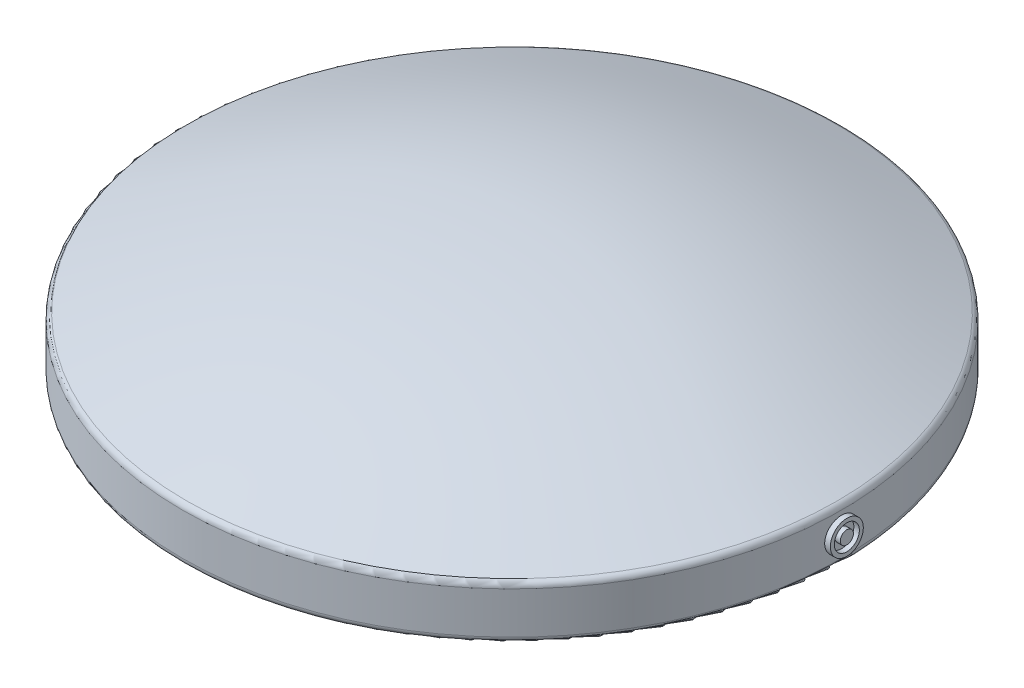
from build123d import *

# Parameters (mm, degrees)
REVOLVE_THIN1_START         = 9.845636472
REVOLVE_THIN1_OUTLINE_R     = 240
REVOLVE_THIN1_DEPTH         = 66.631387698
REVOLVE_THIN1_START_2       = -23.52297593
REVOLVE_THIN1_2_OUTLINE_R   = 250
REVOLVE_THIN1_2_DEPTH       = 10
REVOLVE_THIN1_START_3       = -13.52297593
REVOLVE_THIN1_3_OUTLINE_R   = 250
REVOLVE_THIN1_3_OUTLINE_R_2 = 240
REVOLVE_THIN1_3_DEPTH       = 80.0000001
BOSS_EXTRUDE1_DEPTH         = 254
BOSS_EXTRUDE1_DEPTH_BACK    = 254
SKETCH3_R                   = 12.5
SKETCH3_R_2                 = 9.5
BOSS_EXTRUDE2_DEPTH         = 254
BOSS_EXTRUDE2_DEPTH_BACK    = 254
SKETCH4_R                   = 5


with BuildPart() as part:
    # Revolve-Thin1: read off the stored shape, not the designer's step
    # Revolve-Thin1 outline → Revolve-Thin1 (new body)
    with BuildSketch(Plane(origin=(0, 0, 0), x_dir=(1, 0, 0), z_dir=(0, 1, 0)).offset(REVOLVE_THIN1_START)):
        Circle(REVOLVE_THIN1_OUTLINE_R)
    extrude(amount=REVOLVE_THIN1_DEPTH)



with BuildPart() as body_2:
    # Revolve-Thin1 2 outline → Revolve-Thin1 2 (new body)
    with BuildSketch(Plane(origin=(0, 0, 0), x_dir=(1, 0, 0), z_dir=(0, 1, 0)).offset(REVOLVE_THIN1_START_2)):
        Circle(REVOLVE_THIN1_2_OUTLINE_R)
    extrude(amount=REVOLVE_THIN1_2_DEPTH)


with BuildPart() as part_1:
    add(part.part)

    add(body_2.part)  # Revolve-Thin1 3 merges body 2
    # Revolve-Thin1 3 outline → Revolve-Thin1 3 (add)
    with BuildSketch(Plane(origin=(0, 0, 0), x_dir=(1, 0, 0), z_dir=(0, 1, 0)).offset(REVOLVE_THIN1_START_3)):
        Circle(REVOLVE_THIN1_3_OUTLINE_R)
        Circle(REVOLVE_THIN1_3_OUTLINE_R_2, mode=Mode.SUBTRACT)
    extrude(amount=REVOLVE_THIN1_3_DEPTH)

    # Revolve-Thin1 4 outline → Revolve-Thin1 4 (revolve, cut)
    with BuildSketch(Plane.XY):
        with BuildLine():
            Line((240, 76.47702417), (0, 76.47702407))
            add(Edge.make_bspline(
                [(0, 76.47702407), (107.681425966, 76.47702407), (177.31183066, 47.1242548), (246.942235355, 17.77148553)],
                knots=[0, 0, 0, 0, 1, 1, 1, 1], degree=3))
            ThreePointArc((246.942235355, 17.77148553), (249.166003887, 15.928983252), (250, 13.164130342))
            Line((250, 13.164130342), (250, 66.47702417))
            Line((250, 66.47702417), (240, 66.47702417))
            Line((240, 66.47702417), (240, 76.47702417))
        make_face()
        with BuildLine():
            Line((0, 66.47702407), (0, 9.845636472))
            Line((0, 9.845636472), (240, 9.845636572))
            add(Edge.make_bspline(
                [(240, 9.845636572), (222.857548898, 17.069658758), (205.785831789, 24.221818285), (170.628360108, 37.537406744), (152.543034226, 43.702319594), (114.161379288, 54.236282375), (93.863939615, 58.607156334), (49.823404299, 64.727541835), (26.078506291, 66.47702407), (0, 66.47702407)],
                knots=[0.961643083, 0.961643083, 0.961643083, 0.961643083, 1.211643083, 1.211643083, 1.461643083, 1.461643083, 1.711643083, 1.711643083, 1.961643083, 1.961643083, 1.961643083, 1.961643083], degree=3))
        make_face()
        with BuildLine():
            Line((250, -23.52297593), (250, -18.52297593))
            ThreePointArc((250, -18.52297593), (248.535533906, -22.058509836), (245, -23.52297593))
            Line((245, -23.52297593), (250, -23.52297593))
        make_face()
    revolve(axis=Axis((0, 0, 0), (0, 1, 0)), mode=Mode.SUBTRACT)

    # Sketch3 → Boss-Extrude1 (add, two sides: drawn at the far end of the back side and taken through both)
    with BuildSketch(Plane(origin=(0, 0, 0), x_dir=(0, 0, -1), z_dir=(1, 0, 0)).offset(-BOSS_EXTRUDE1_DEPTH_BACK)):
        with Locations((0, -2.679422794)):
            Circle(SKETCH3_R)
        with Locations((0, -2.679422794)):
            Circle(SKETCH3_R_2, mode=Mode.SUBTRACT)
    extrude(amount=BOSS_EXTRUDE1_DEPTH + BOSS_EXTRUDE1_DEPTH_BACK)

    # Sketch4 → Boss-Extrude2 (add, two sides: drawn at the far end of the back side and taken through both)
    with BuildSketch(Plane(origin=(0, 0, 0), x_dir=(0, 0, -1), z_dir=(1, 0, 0)).offset(-BOSS_EXTRUDE2_DEPTH_BACK)):
        with Locations((0, -2.679422794)):
            Circle(SKETCH4_R)
    extrude(amount=BOSS_EXTRUDE2_DEPTH + BOSS_EXTRUDE2_DEPTH_BACK)


solid = part_1.part
